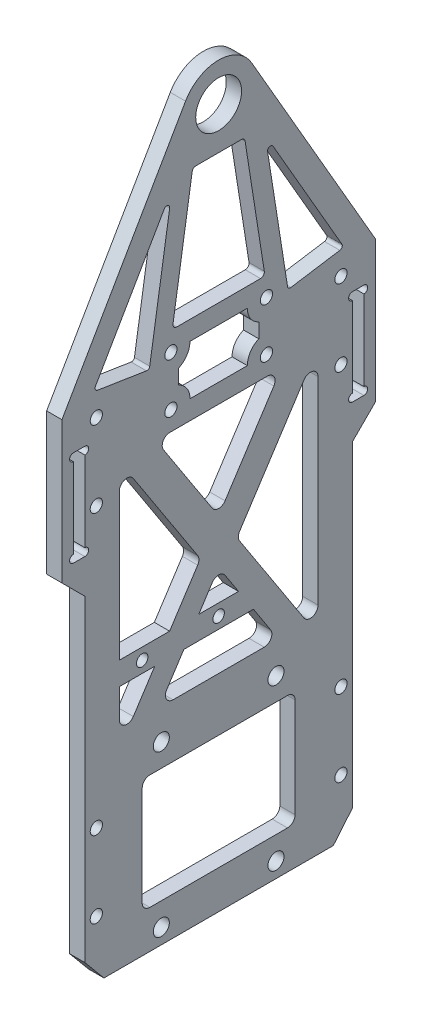
from build123d import *

# Parameters (mm, degrees)
SKETCH_1_W           = 60
SKETCH_1_H           = 50
SKETCH_1_R           = 2.1
EXTRUDE_1_DEPTH      = 4
EXTRUDE_2_DEPTH      = 4
SKETCH_4_W           = 40
SKETCH_4_H           = 30
CUT_EXTRUDE_2_DEPTH  = 4
EXTRUDE_4_DEPTH      = 4
SKETCH_10_W          = 6
SKETCH_10_H          = 10
SKETCH_10_W_2        = 3
EXTRUDE_5_DEPTH      = 4
CHAMFER_1_SIZE       = 7
CUT_EXTRUDE_7_DEPTH  = 10
SKETCH_15_R          = 17.5
SKETCH_15_R_2        = 6
SKETCH_15_W          = 82
SKETCH_15_H          = 10
EXTRUDE_7_DEPTH      = 4
SKETCH_16_R          = 1.6
CUT_EXTRUDE_9_DEPTH  = 4
EXTRUDE_8_DEPTH      = 4
CUT_EXTRUDE_12_DEPTH = 10
SKETCH_22_R          = 1.6
CUT_EXTRUDE_13_DEPTH = 213.737514322
CUT_EXTRUDE_14_DEPTH = 213.737514322
SKETCH_24_R          = 1.6
CUT_EXTRUDE_15_DEPTH = 206.684223994
FILLET_1_R           = 2
SKETCH_26_R          = 1.5
EXTRUDE_9_DEPTH      = 4


with BuildPart() as part:
    # 草图1 → 凸台-拉伸1 (new body)
    with BuildSketch(Plane(origin=(0, 0, 0), x_dir=(0, 0, -1), z_dir=(1, 0, 0))):
        with Locations((30, 25)):
            Rectangle(SKETCH_1_W, SKETCH_1_H)
        with Locations((15, 4)):
            Circle(SKETCH_1_R, mode=Mode.SUBTRACT)
        with Locations((15, 46)):
            Circle(SKETCH_1_R, mode=Mode.SUBTRACT)
        with Locations(Location((45, 4, 0), (0, 0, 180))):
            Circle(SKETCH_1_R, mode=Mode.SUBTRACT)
        with Locations(Location((45, 46, 0), (0, 0, 180))):
            Circle(SKETCH_1_R, mode=Mode.SUBTRACT)
    extrude(amount=EXTRUDE_1_DEPTH)

    # 草图3 → 凸台-拉伸2 (add)
    with BuildSketch(Plane(origin=(4, 0, 0), x_dir=(0, 0, -1), z_dir=(1, 0, 0))):
        Polygon((0, 50), (-10, 38), (-10, 12), (0, 0), align=None)
        Polygon((70, 12), (60, 0), (60, 50), (70, 38), align=None)
    extrude(amount=-EXTRUDE_2_DEPTH)

    # 草图4 → 切除-拉伸2 (cut)
    with BuildSketch(Plane(origin=(4, 0, 0), x_dir=(0, 0, -1), z_dir=(1, 0, 0))):
        with Locations((30, 25)):
            Rectangle(SKETCH_4_W, SKETCH_4_H)
    extrude(amount=-CUT_EXTRUDE_2_DEPTH, mode=Mode.SUBTRACT)

    # 草图9 → 凸台-拉伸4 (add)
    with BuildSketch(Plane(origin=(4, 0, 0), x_dir=(0, 0, -1), z_dir=(1, 0, 0))):
        Polygon((60, 50), (65, 50), (65, 133), (60, 133), (0, 133), (-5, 133), (-5, 50), (0, 50), align=None)
        Polygon((-5, 50), (-5, 44), (0, 50), align=None)
        Polygon((65, 44), (60, 50), (65, 50), align=None)
    extrude(amount=-EXTRUDE_4_DEPTH)

    # 草图10 → 凸台-拉伸5 (add)
    with BuildSketch(Plane(origin=(4, 0, 0), x_dir=(0, 0, -1), z_dir=(1, 0, 0))):
        with Locations((-8, 128)):
            Rectangle(SKETCH_10_W, SKETCH_10_H)
        Polygon((-8, 123), (-11, 123), (-11, 88), (-8, 88), (-8, 98), align=None)
        with Locations((-6.5, 93)):
            Rectangle(SKETCH_10_W_2, SKETCH_10_H)
        with Locations((66.5, 93)):
            Rectangle(SKETCH_10_W_2, SKETCH_10_H)
        Polygon((68, 98), (68, 88), (71, 88), (71, 123), (68, 123), align=None)
        Polygon((65, 123), (68, 123), (71, 123), (71, 133), (65, 133), align=None)
    extrude(amount=-EXTRUDE_5_DEPTH)

    # 倒角1
    # the kernel refuses this chamfer: 7 mm, written as the material it takes off along each edge
    with BuildSketch(Plane(origin=(22.001780916, 88, -71), x_dir=(0, 0.9996219169112968, -0.027495876610586126), z_dir=(-1, 0, 0))) as chamfer_1_piece_1_section:
        Polygon((CHAMFER_1_SIZE * 0.999621916911, -CHAMFER_1_SIZE * 0.0274958766106), (-CHAMFER_1_SIZE * 0.0274958766106, -CHAMFER_1_SIZE * 0.999621916911), (0, 0), align=None)
    chamfer_1_piece_1 = extrude(amount=40.003561832, mode=Mode.PRIVATE)
    chamfer_1_piece_1 = split(chamfer_1_piece_1, bisect_by=Plane(origin=(2, 90.377464073, -65), z_dir=(0, 0, -1)), keep=Keep.TOP, mode=Mode.PRIVATE)
    add(chamfer_1_piece_1, mode=Mode.SUBTRACT)
    with BuildSketch(Plane(origin=(22.001780916, 88, 11), x_dir=(0, -0.02749587661058612, -0.9996219169112968), z_dir=(-1, 0, 0))) as chamfer_1_piece_2_section:
        Polygon((CHAMFER_1_SIZE * 0.999621916911, -CHAMFER_1_SIZE * 0.0274958766106), (-CHAMFER_1_SIZE * 0.0274958766106, -CHAMFER_1_SIZE * 0.999621916911), (0, 0), align=None)
    chamfer_1_piece_2 = extrude(amount=40.003561832, mode=Mode.PRIVATE)
    chamfer_1_piece_2 = split(chamfer_1_piece_2, bisect_by=Plane(origin=(2, 90.377464073, 5), z_dir=(0, 0, 1)), keep=Keep.TOP, mode=Mode.PRIVATE)
    add(chamfer_1_piece_2, mode=Mode.SUBTRACT)

    # 草图11 → 切除-拉伸7 (cut)
    with BuildSketch(Plane.ZY):
        with BuildLine():
            Line((-56, 108.259816518), (-56, 56.5))
            ThreePointArc((-56, 56.5), (-54.568937243, 54.582629297), (-52.323689586, 55.409136399))
            Line((-52.323689586, 55.409136399), (-35.482268273, 81.289044658))
            ThreePointArc((-35.482268273, 81.289044658), (-35.158578687, 82.379908259), (-35.482268273, 83.470771861))
            Line((-35.482268273, 83.470771861), (-52.323689586, 109.35068012))
            ThreePointArc((-52.323689586, 109.35068012), (-54.568937243, 110.177187221), (-56, 108.259816518))
        make_face()
        with BuildLine():
            Line((-42.767530034, 115), (-17.232469966, 115))
            ThreePointArc((-17.232469966, 115), (-15.474384757, 113.953486444), (-15.556159552, 111.909136399))
            Line((-15.556159552, 111.909136399), (-28.323689586, 92.289503362))
            ThreePointArc((-28.323689586, 92.289503362), (-30, 91.380366964), (-31.676310414, 92.289503362))
            Line((-31.676310414, 92.289503362), (-44.443840448, 111.909136399))
            ThreePointArc((-44.443840448, 111.909136399), (-44.525615243, 113.953486444), (-42.767530034, 115))
        make_face()
        with BuildLine():
            Line((-31.676310414, 75.415535463), (-43.60114091, 57.090863601))
            ThreePointArc((-43.60114091, 57.090863601), (-43.682915705, 55.046513556), (-41.924830496, 54))
            Line((-41.924830496, 54), (-18.075169504, 54))
            ThreePointArc((-18.075169504, 54), (-16.317084295, 55.046513556), (-16.39885909, 57.090863601))
            Line((-16.39885909, 57.090863601), (-28.323689586, 75.415535463))
            ThreePointArc((-28.323689586, 75.415535463), (-30, 76.324671862), (-31.676310414, 75.415535463))
        make_face()
        with BuildLine():
            Line((-24.517731727, 83.470771861), (-7.676310414, 109.35068012))
            ThreePointArc((-7.676310414, 109.35068012), (-5.431062757, 110.177187221), (-4, 108.259816518))
            Line((-4, 108.259816518), (-4, 56.5))
            ThreePointArc((-4, 56.5), (-5.431062757, 54.582629297), (-7.676310414, 55.409136399))
            Line((-7.676310414, 55.409136399), (-24.517731727, 81.289044658))
            ThreePointArc((-24.517731727, 81.289044658), (-24.841421313, 82.379908259), (-24.517731727, 83.470771861))
        make_face()
    extrude(amount=-CUT_EXTRUDE_7_DEPTH, mode=Mode.SUBTRACT)

    # 草图15 → 凸台-拉伸7 (add)
    # profile 1 of 3: a face of its own
    with BuildSketch(Plane.ZY):
        with Locations((-30, 183)):
            Circle(SKETCH_15_R)
        with Locations((-30, 183)):
            Circle(SKETCH_15_R_2, mode=Mode.SUBTRACT)
    # profile 2 of 3: a face of its own
    with BuildSketch(Plane.ZY):
        with BuildLine():
            Line((-47.5, 183), (-47.5, 143))
            Line((-47.5, 143), (-12.5, 143))
            Line((-12.5, 143), (-12.5, 183))
            ThreePointArc((-12.5, 183), (-30, 165.5), (-47.5, 183))
        make_face()
    # profile 3 of 3: a face of its own
    with BuildSketch(Plane.ZY):
        with Locations((-30, 138)):
            Rectangle(SKETCH_15_W, SKETCH_15_H)
    extrude(amount=-EXTRUDE_7_DEPTH)

    # 草图16 → 切除-拉伸9 (cut)
    with BuildSketch(Plane(origin=(4, 0, 0), x_dir=(0, 0, -1), z_dir=(1, 0, 0))):
        with Locations((-2, 128)):
            Circle(SKETCH_16_R)
        with Locations((-2, 108)):
            Circle(SKETCH_16_R)
        with Locations((62, 108)):
            Circle(SKETCH_16_R)
        with Locations((62, 128)):
            Circle(SKETCH_16_R)
    extrude(amount=-CUT_EXTRUDE_9_DEPTH, mode=Mode.SUBTRACT)

    # 草图17 → 凸台-拉伸8 (add)
    with BuildSketch(Plane(origin=(4, 0, 0), x_dir=(0, 0, -1), z_dir=(1, 0, 0))):
        Polygon((-11, 143), (12.5, 183), (12.5, 143), align=None)
        Polygon((47.5, 183), (71, 143), (47.5, 143), align=None)
    extrude(amount=-EXTRUDE_8_DEPTH)

    # 草图21 → 切除-拉伸12 (cut)
    with BuildSketch(Plane(origin=(4, 0, 0), x_dir=(0, 0, -1), z_dir=(1, 0, 0))):
        with BuildLine():
            Line((68, 123), (68, 121))
            ThreePointArc((68, 121), (69, 122), (68, 123))
        make_face()
        with BuildLine():
            Line((68, 98), (68, 100))
            ThreePointArc((68, 100), (69, 99), (68, 98))
        make_face()
        with BuildLine():
            Line((65, 98), (65, 100))
            ThreePointArc((65, 100), (64, 99), (65, 98))
        make_face()
        with BuildLine():
            Line((65, 123), (65, 121))
            ThreePointArc((65, 121), (64, 122), (65, 123))
        make_face()
        with BuildLine():
            Line((-8, 123), (-8, 121))
            ThreePointArc((-8, 121), (-9, 122), (-8, 123))
        make_face()
        with BuildLine():
            Line((-8, 98), (-8, 100))
            ThreePointArc((-8, 100), (-9, 99), (-8, 98))
        make_face()
        with BuildLine():
            Line((-5, 98), (-5, 100))
            ThreePointArc((-5, 100), (-4, 99), (-5, 98))
        make_face()
        with BuildLine():
            Line((-5, 123), (-5, 121))
            ThreePointArc((-5, 121), (-4, 122), (-5, 123))
        make_face()
    extrude(amount=-CUT_EXTRUDE_12_DEPTH, mode=Mode.SUBTRACT)

    # 草图22 → 切除-拉伸13 (cut, through all)
    with BuildSketch(Plane.ZY):
        with Locations((-42.5, 133)):
            Circle(SKETCH_22_R)
        with Locations((-17.5, 133)):
            Circle(SKETCH_22_R)
        with Locations((-42.5, 120)):
            Circle(SKETCH_22_R)
        with Locations((-17.5, 120)):
            Circle(SKETCH_22_R)
    extrude(amount=-CUT_EXTRUDE_13_DEPTH, mode=Mode.SUBTRACT)

    # 草图23 → 切除-拉伸14 (cut, through all)
    with BuildSketch(Plane.ZY):
        with BuildLine():
            Line((-38.659709546, 188.000942969), (-71, 132))
            Line((-71, 132), (-71, 143))
            Line((-71, 143), (-47.5, 183))
            ThreePointArc((-47.5, 183), (-30, 200.5), (-12.5, 183))
            Line((-12.5, 183), (11, 143))
            Line((11, 143), (11, 132))
            Line((11, 132), (-21.340290454, 188.000942969))
            ThreePointArc((-21.340290454, 188.000942969), (-30, 193), (-38.659709546, 188.000942969))
        make_face()
        with BuildLine():
            Line((-40.5, 128.417424305), (-40.5, 124.582575695))
            ThreePointArc((-40.5, 124.582575695), (-38.316699867, 122.738612788), (-37.5, 120))
            Line((-37.5, 120), (-22.5, 120))
            ThreePointArc((-22.5, 120), (-21.683300133, 122.738612788), (-19.5, 124.582575695))
            Line((-19.5, 124.582575695), (-19.5, 128.417424305))
            ThreePointArc((-19.5, 128.417424305), (-21.683300133, 130.261387212), (-22.5, 133))
            Line((-22.5, 133), (-37.5, 133))
            ThreePointArc((-37.5, 133), (-38.316699867, 130.261387212), (-40.5, 128.417424305))
        make_face()
        with BuildLine():
            Line((-42.809980264, 165.878596296), (-48.025949362, 132.64934701))
            ThreePointArc((-48.025949362, 132.64934701), (-48.329217572, 132.152920832), (-48.894686896, 132.016337524))
            Line((-48.894686896, 132.016337524), (-61.707032096, 134.027481262))
            ThreePointArc((-61.707032096, 134.027481262), (-62.274985772, 134.450700931), (-62.247364652, 135.15846031))
            Line((-62.247364652, 135.15846031), (-44.219050354, 166.376565857))
            ThreePointArc((-44.219050354, 166.376565857), (-43.307593682, 166.713092919), (-42.809980264, 165.878596296))
        make_face()
        with BuildLine():
            Line((-36.920512772, 171.155070422), (-41.943527577, 139.155070422))
            ThreePointArc((-41.943527577, 139.155070422), (-41.715581533, 138.350027086), (-40.955624159, 138))
            Line((-40.955624159, 138), (-19.044375841, 138))
            ThreePointArc((-19.044375841, 138), (-18.284418467, 138.350027086), (-18.056472423, 139.155070422))
            Line((-18.056472423, 139.155070422), (-23.079487228, 171.155070422))
            ThreePointArc((-23.079487228, 171.155070422), (-23.417417732, 171.759957374), (-24.067390646, 172))
            Line((-24.067390646, 172), (-35.932609354, 172))
            ThreePointArc((-35.932609354, 172), (-36.582582268, 171.759957374), (-36.920512772, 171.155070422))
        make_face()
        with BuildLine():
            Line((-11.105313104, 132.016337524), (1.707032096, 134.027481262))
            ThreePointArc((1.707032096, 134.027481262), (2.274985772, 134.450700931), (2.247364652, 135.15846031))
            Line((2.247364652, 135.15846031), (-15.780949646, 166.376565857))
            ThreePointArc((-15.780949646, 166.376565857), (-16.692406318, 166.713092919), (-17.190019736, 165.878596296))
            Line((-17.190019736, 165.878596296), (-11.974050638, 132.64934701))
            ThreePointArc((-11.974050638, 132.64934701), (-11.670782428, 132.152920832), (-11.105313104, 132.016337524))
        make_face()
    extrude(amount=-CUT_EXTRUDE_14_DEPTH, mode=Mode.SUBTRACT)

    # 草图24 → 切除-拉伸15 (cut, through all)
    with BuildSketch(Plane(origin=(4, 0, 0), x_dir=(0, 0, -1), z_dir=(1, 0, 0))):
        with Locations((-2, 35)):
            Circle(SKETCH_24_R)
        with Locations((-2, 15)):
            Circle(SKETCH_24_R)
        with Locations(Location((62, 15, 0), (0, 0, 180))):
            Circle(SKETCH_24_R)
        with Locations(Location((62, 35, 0), (0, 0, 180))):
            Circle(SKETCH_24_R)
        Polygon((-5, 44), (-5, 6), (-10, 12), (-10, 38), align=None)
        Polygon((65, 44), (65, 6), (70, 12), (70, 38), align=None)
    extrude(amount=-CUT_EXTRUDE_15_DEPTH, mode=Mode.SUBTRACT)

    # 圆角1
    fillet_1_edges = [part.edges().sort_by_distance(p)[0] for p in [
        (2, 10, -50),
        (2, 10, -10),
        (2, 40, -10),
        (2, 40, -50),
    ]]
    fillet(fillet_1_edges, radius=FILLET_1_R)

    # 草图26 → 凸台-拉伸9 (add)
    with BuildSketch(Plane.ZY):
        Polygon((-35.200484976, 70), (-4, 70), (-4, 64), (-39.10500144, 64), align=None)
        with Locations((-30, 67)):
            Circle(SKETCH_26_R, mode=Mode.SUBTRACT)
        with Locations((-10, 67)):
            Circle(SKETCH_26_R, mode=Mode.SUBTRACT)
    extrude(amount=-EXTRUDE_9_DEPTH)


solid = part.part
